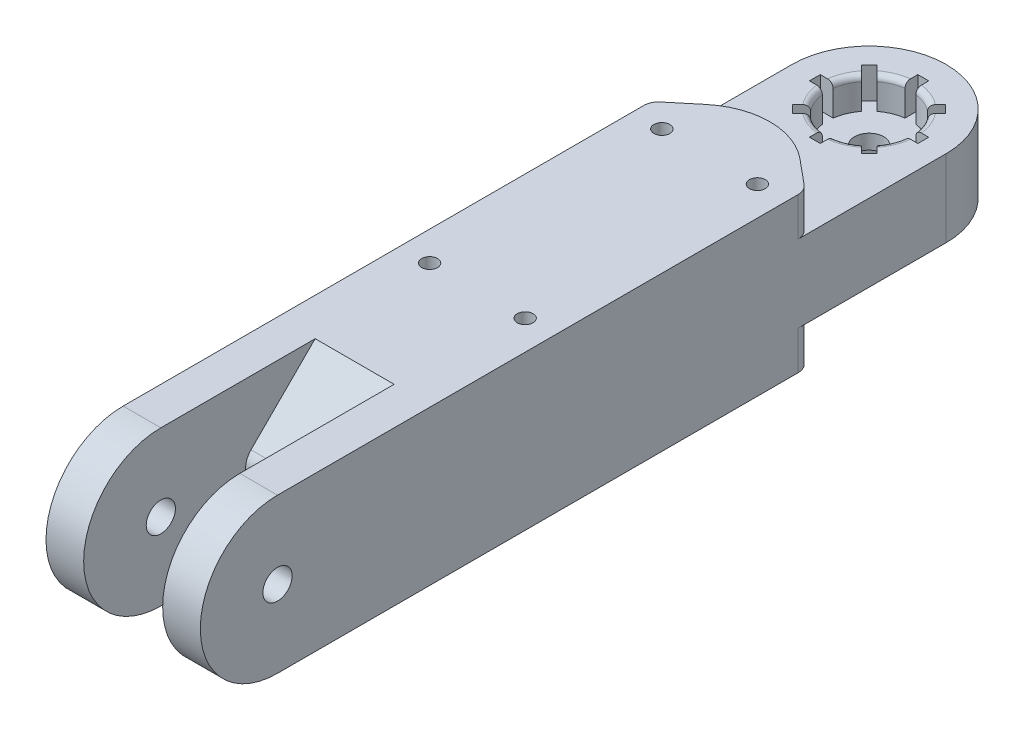
from build123d import *

# Parameters (mm, degrees)
SKETCH1_W                = 42
SKETCH1_H                = 42
BOSS_EXTRUDE1_DEPTH      = 140
SKETCH2_W                = 10.25
SKETCH2_H                = 42
BOSS_EXTRUDE2_DEPTH      = 21
BOSS_EXTRUDE4_DEPTH      = 10.25
BOSS_EXTRUDE5_START      = -10.25
BOSS_EXTRUDE5_DEPTH      = 10.25
SKETCH6_R                = 3.975
CUT_EXTRUDE1_DEPTH       = 186.93832983
SKETCH8_R                = 3.975
CUT_EXTRUDE2_DEPTH       = 186.93832983
SKETCH9_W                = 42
SKETCH9_H                = 21
BOSS_EXTRUDE6_DEPTH      = 21
BOSS_EXTRUDE7_DEPTH      = 21
SKETCH11_R               = 11.35
CUT_EXTRUDE3_DEPTH       = 8.5
CUT_EXTRUDE4_DEPTH       = 21.5
FILLET1_R                = 5
CUT_EXTRUDE5_START       = -8.5
SKETCH18_R               = 11.35
CUT_EXTRUDE5_DEPTH       = 8.5
SKETCH19_R               = 3.975
CUT_EXTRUDE6_DEPTH       = 8.5
FILLET4_R                = 1.5
FILLET5_R                = 1.5
SKETCH20_W               = 2.96
SKETCH20_H               = 3.81
CUT_EXTRUDE7_DEPTH       = 8.5
CIRPATTERN1_COUNT        = 8
MIRROR1_COPY_1_SKETCH_W  = 2.96
MIRROR1_COPY_1_SKETCH_H  = 3.81
MIRROR1_COPY_1_DEPTH     = 8.5
MIRROR1_COPY_2_SKETCH_W  = 2.96
MIRROR1_COPY_2_SKETCH_H  = 3.81
MIRROR1_COPY_2_DEPTH     = 8.5
MIRROR1_COPY_3_SKETCH_W  = 2.96
MIRROR1_COPY_3_SKETCH_H  = 3.81
MIRROR1_COPY_3_DEPTH     = 8.5
MIRROR1_COPY_4_SKETCH_W  = 2.96
MIRROR1_COPY_4_SKETCH_H  = 3.81
MIRROR1_COPY_4_DEPTH     = 8.5
MIRROR1_COPY_5_SKETCH_W  = 2.96
MIRROR1_COPY_5_SKETCH_H  = 3.81
MIRROR1_COPY_5_DEPTH     = 8.5
MIRROR1_COPY_6_SKETCH_W  = 2.96
MIRROR1_COPY_6_SKETCH_H  = 3.81
MIRROR1_COPY_6_DEPTH     = 8.5
MIRROR1_COPY_7_SKETCH_W  = 2.96
MIRROR1_COPY_7_SKETCH_H  = 3.81
MIRROR1_COPY_7_DEPTH     = 8.5
MIRROR1_COPY_8_SKETCH_W  = 2.96
MIRROR1_COPY_8_SKETCH_H  = 3.81
MIRROR1_COPY_8_DEPTH     = 8.5
SKETCH25_W               = 34
SKETCH25_H               = 49
CUT_EXTRUDE11_DEPTH      = 32
SKETCH26_W               = 34
SKETCH26_H               = 11.1
CUT_EXTRUDE12_DEPTH      = 27
SKETCH30_R               = 2.15
CUT_EXTRUDE13_DEPTH      = 186.186392589
FILLET10_R               = 3
MIRROR12_COPY_1_SKETCH_R = 2.15
MIRROR12_COPY_1_DEPTH    = 186.186392589
FILLET10_OF_MIRROR12_R   = 3
CUT_EXTRUDE16_DEPTH      = 10.5
FILLET12_R               = 20
FILLET12_OF_MIRROR13_R   = 20
FILLET13_R               = 4


with BuildPart() as part:
    # Sketch1 → Boss-Extrude1 (new body)
    with BuildSketch(Plane.XY):
        Rectangle(SKETCH1_W, SKETCH1_H)
    extrude(amount=BOSS_EXTRUDE1_DEPTH)

    # Sketch2 → Boss-Extrude2 (add)
    with BuildSketch(Plane.XY.offset(140)):
        with Locations((-15.875, 0)):
            Rectangle(SKETCH2_W, SKETCH2_H)
        with Locations((15.875, 0)):
            Rectangle(SKETCH2_W, SKETCH2_H)
    extrude(amount=BOSS_EXTRUDE2_DEPTH)

    # Sketch5 → Boss-Extrude4 (add)
    with BuildSketch(Plane.ZY.offset(-10.75)):
        with BuildLine():
            ThreePointArc((161, -21), (182, 0), (161, 21))
            Line((161, 21), (161, -21))
        make_face()
    extrude(amount=-BOSS_EXTRUDE4_DEPTH)

    # Sketch3 → Boss-Extrude5 (add)
    with BuildSketch(Plane(origin=(-10.75, 0, 0), x_dir=(0, 0, -1), z_dir=(1, 0, 0)).offset(BOSS_EXTRUDE5_START)):
        with BuildLine():
            Line((-161, -21), (-161, 21))
            ThreePointArc((-161, 21), (-182, 0), (-161, -21))
        make_face()
    extrude(amount=BOSS_EXTRUDE5_DEPTH)

    # Sketch6 → Cut-Extrude1 (cut, through all)
    with BuildSketch(Plane.ZY.offset(-10.75)):
        with Locations((161, 0)):
            Circle(SKETCH6_R)
    extrude(amount=-CUT_EXTRUDE1_DEPTH, mode=Mode.SUBTRACT)

    # Sketch8 → Cut-Extrude2 (cut, through all)
    with BuildSketch(Plane(origin=(-10.75, 0, 0), x_dir=(0, 0, -1), z_dir=(1, 0, 0))):
        with Locations((-161, 0)):
            Circle(SKETCH8_R)
    extrude(amount=-CUT_EXTRUDE2_DEPTH, mode=Mode.SUBTRACT)

    # Sketch9 → Boss-Extrude6 (add)
    with BuildSketch(Plane(origin=(0, 0, 0), x_dir=(-1, 0, 0), z_dir=(0, 0, -1))):
        Rectangle(SKETCH9_W, SKETCH9_H)
    extrude(amount=BOSS_EXTRUDE6_DEPTH)

    # Sketch10 → Boss-Extrude7 (add)
    with BuildSketch(Plane(origin=(0, -10.5, 0), x_dir=(-1, 0, 0), z_dir=(0, -1, 0))):
        with BuildLine():
            Line((-21, 21), (21, 21))
            ThreePointArc((21, 21), (0, 42), (-21, 21))
        make_face()
    extrude(amount=-BOSS_EXTRUDE7_DEPTH)

    # Sketch11 → Cut-Extrude3 (cut)
    with BuildSketch(Plane(origin=(0, -10.5, 0), x_dir=(-1, 0, 0), z_dir=(0, -1, 0))):
        with Locations((0, 21)):
            Circle(SKETCH11_R)
    extrude(amount=-CUT_EXTRUDE3_DEPTH, mode=Mode.SUBTRACT)

    # Sketch16 → Cut-Extrude4 (cut)
    with BuildSketch(Plane.ZY.offset(-10.75)):
        Polygon((140, -21), (140, 0), (119, -21), align=None)
        Polygon((140, 0), (140, 21), (119, 21), align=None)
    extrude(amount=CUT_EXTRUDE4_DEPTH, mode=Mode.SUBTRACT)

    # Fillet1
    fillet1_edges = [part.edges().sort_by_distance(p)[0] for p in [
        (0, 0, 140),
    ]]
    fillet(fillet1_edges, radius=FILLET1_R)

    # Sketch18 → Cut-Extrude5 (cut)
    with BuildSketch(Plane(origin=(0, 10.5, 0), x_dir=(1, 0, 0), z_dir=(0, 1, 0)).offset(CUT_EXTRUDE5_START)):
        with Locations((0, 21)):
            Circle(SKETCH18_R)
    extrude(amount=CUT_EXTRUDE5_DEPTH, mode=Mode.SUBTRACT)

    # Sketch19 → Cut-Extrude6 (cut)
    with BuildSketch(Plane.XZ.offset(2)):
        with Locations((0, -21)):
            Circle(SKETCH19_R)
    extrude(amount=-CUT_EXTRUDE6_DEPTH, mode=Mode.SUBTRACT)

    # Fillet4
    fillet4_edges = [part.edges().sort_by_distance(p)[0] for p in [
        (11.35, -10.5, -21),
    ]]
    fillet(fillet4_edges, radius=FILLET4_R)

    # Fillet5
    fillet5_edges = [part.edges().sort_by_distance(p)[0] for p in [
        (-11.35, 10.5, -21),
    ]]
    fillet(fillet5_edges, radius=FILLET5_R)

    # Sketch20 → Cut-Extrude7 (cut)
    with BuildSketch(Plane(origin=(0, 10.5, 0), x_dir=(1, 0, 0), z_dir=(0, 1, 0))):
        with Locations((0, 33.85)):
            Rectangle(SKETCH20_W, SKETCH20_H)
    cut_extrude7 = extrude(amount=-CUT_EXTRUDE7_DEPTH, mode=Mode.SUBTRACT)

    # CirPattern1: Cut-Extrude7 ×8 about axis
    cirpattern1_axis = Axis((0, 2, -21), (0, 1, 0))
    for i in range(1, CIRPATTERN1_COUNT):
        add(cut_extrude7.rotate(cirpattern1_axis, i * 360 / CIRPATTERN1_COUNT), mode=Mode.SUBTRACT)

    # Mirror1 copy 1 sketch → Mirror1 copy 1 (cut)
    with BuildSketch(Plane(origin=(14.849242405, -10.5, -6.150757595), x_dir=(0.7071067811865476, 0, -0.7071067811865475), z_dir=(0, -1, 0))):
        with Locations((0, -33.85)):
            Rectangle(MIRROR1_COPY_1_SKETCH_W, MIRROR1_COPY_1_SKETCH_H)
    extrude(amount=-MIRROR1_COPY_1_DEPTH, mode=Mode.SUBTRACT)

    # Mirror1 copy 2 sketch → Mirror1 copy 2 (cut)
    with BuildSketch(Plane(origin=(21, -10.5, -21), x_dir=(0, 0, -1), z_dir=(0, -1, 0))):
        with Locations((0, -33.85)):
            Rectangle(MIRROR1_COPY_2_SKETCH_W, MIRROR1_COPY_2_SKETCH_H)
    extrude(amount=-MIRROR1_COPY_2_DEPTH, mode=Mode.SUBTRACT)

    # Mirror1 copy 3 sketch → Mirror1 copy 3 (cut)
    with BuildSketch(Plane(origin=(14.849242405, -10.5, -35.849242405), x_dir=(-0.7071067811865475, 0, -0.7071067811865476), z_dir=(0, -1, 0))):
        with Locations((0, -33.85)):
            Rectangle(MIRROR1_COPY_3_SKETCH_W, MIRROR1_COPY_3_SKETCH_H)
    extrude(amount=-MIRROR1_COPY_3_DEPTH, mode=Mode.SUBTRACT)

    # Mirror1 copy 4 sketch → Mirror1 copy 4 (cut)
    with BuildSketch(Plane(origin=(0, -10.5, -42), x_dir=(-1, 0, 0), z_dir=(0, -1, 0))):
        with Locations((0, -33.85)):
            Rectangle(MIRROR1_COPY_4_SKETCH_W, MIRROR1_COPY_4_SKETCH_H)
    extrude(amount=-MIRROR1_COPY_4_DEPTH, mode=Mode.SUBTRACT)

    # Mirror1 copy 5 sketch → Mirror1 copy 5 (cut)
    with BuildSketch(Plane(origin=(-14.849242405, -10.5, -35.849242405), x_dir=(-0.7071067811865477, 0, 0.7071067811865475), z_dir=(0, -1, 0))):
        with Locations((0, -33.85)):
            Rectangle(MIRROR1_COPY_5_SKETCH_W, MIRROR1_COPY_5_SKETCH_H)
    extrude(amount=-MIRROR1_COPY_5_DEPTH, mode=Mode.SUBTRACT)

    # Mirror1 copy 6 sketch → Mirror1 copy 6 (cut)
    with BuildSketch(Plane(origin=(-21, -10.5, -21), x_dir=(0, 0, 1), z_dir=(0, -1, 0))):
        with Locations((0, -33.85)):
            Rectangle(MIRROR1_COPY_6_SKETCH_W, MIRROR1_COPY_6_SKETCH_H)
    extrude(amount=-MIRROR1_COPY_6_DEPTH, mode=Mode.SUBTRACT)

    # Mirror1 copy 7 sketch → Mirror1 copy 7 (cut)
    with BuildSketch(Plane(origin=(-14.849242405, -10.5, -6.150757595), x_dir=(0.7071067811865474, 0, 0.7071067811865477), z_dir=(0, -1, 0))):
        with Locations((0, -33.85)):
            Rectangle(MIRROR1_COPY_7_SKETCH_W, MIRROR1_COPY_7_SKETCH_H)
    extrude(amount=-MIRROR1_COPY_7_DEPTH, mode=Mode.SUBTRACT)

    # Mirror1 copy 8 sketch → Mirror1 copy 8 (cut)
    with BuildSketch(Plane.XZ.offset(10.5)):
        with Locations((0, -33.85)):
            Rectangle(MIRROR1_COPY_8_SKETCH_W, MIRROR1_COPY_8_SKETCH_H)
    extrude(amount=-MIRROR1_COPY_8_DEPTH, mode=Mode.SUBTRACT)

    # Sketch25 → Cut-Extrude11 (cut)
    with BuildSketch(Plane.XZ.offset(21)):
        with Locations((0, 54)):
            Rectangle(SKETCH25_W, SKETCH25_H)
    extrude(amount=-CUT_EXTRUDE11_DEPTH, mode=Mode.SUBTRACT)

    # Sketch26 → Cut-Extrude12 (cut)
    with BuildSketch(Plane.XZ.offset(21)):
        with Locations((0, 23.95)):
            Rectangle(SKETCH26_W, SKETCH26_H)
    cut_extrude12 = extrude(amount=-CUT_EXTRUDE12_DEPTH, mode=Mode.SUBTRACT)

    # Sketch30 → Cut-Extrude13 (cut, through all)
    with BuildSketch(Plane.XZ.offset(-6)):
        with Locations((-13, 22.4)):
            Circle(SKETCH30_R)
    cut_extrude13 = extrude(amount=-CUT_EXTRUDE13_DEPTH, mode=Mode.SUBTRACT)

    # Mirror9: Cut-Extrude13 across plane
    add(cut_extrude13.mirror(Plane.ZY), mode=Mode.SUBTRACT)

    # Fillet10
    fillet10_edges = [part.edges().sort_by_distance(p)[0] for p in [
        (-17, -7.5, 18.4),
        (17, -7.5, 18.4),
    ]]
    fillet(fillet10_edges, radius=FILLET10_R)

    # Mirror12: Cut-Extrude12, Cut-Extrude13 across plane
    add(cut_extrude12.mirror(Plane(origin=(0, 0, 54), x_dir=(1, 0, 0), z_dir=(0, 0, -1))), mode=Mode.SUBTRACT)
    add(cut_extrude13.mirror(Plane(origin=(0, 0, 54), x_dir=(1, 0, 0), z_dir=(0, 0, -1))), mode=Mode.SUBTRACT)

    # Mirror12 copy 1 sketch → Mirror12 copy 1 (cut, through all)
    with BuildSketch(Plane(origin=(0, 6, 108), x_dir=(-1, 0, 0), z_dir=(0, -1, 0))):
        with Locations((-13, 22.4)):
            Circle(MIRROR12_COPY_1_SKETCH_R)
    extrude(amount=-MIRROR12_COPY_1_DEPTH, mode=Mode.SUBTRACT)

    # Fillet10 of Mirror12
    fillet10_of_mirror12_edges = [part.edges().sort_by_distance(p)[0] for p in [
        (-17, -7.5, 89.6),
        (17, -7.5, 89.6),
    ]]
    fillet(fillet10_of_mirror12_edges, radius=FILLET10_OF_MIRROR12_R)

    # Sketch32 → Cut-Extrude16 (cut)
    with BuildSketch(Plane(origin=(0, 21, 0), x_dir=(1, 0, 0), z_dir=(0, 1, 0))):
        Polygon((21, 0), (0, 0), (21, -17.421516408), align=None)
        Polygon((-21, -17.421516408), (0, 0), (-21, 0), align=None)
    cut_extrude16 = extrude(amount=-CUT_EXTRUDE16_DEPTH, mode=Mode.SUBTRACT)

    # Fillet12
    fillet12_edges = [part.edges().sort_by_distance(p)[0] for p in [
        (0, 15.75, 0),
    ]]
    fillet(fillet12_edges, radius=FILLET12_R)

    # Mirror13: Cut-Extrude16 across plane
    add(cut_extrude16.mirror(Plane.ZX), mode=Mode.SUBTRACT)

    # Fillet12 of Mirror13
    fillet12_of_mirror13_edges = [part.edges().sort_by_distance(p)[0] for p in [
        (0, -15.75, 0),
    ]]
    fillet(fillet12_of_mirror13_edges, radius=FILLET12_OF_MIRROR13_R)

    # Fillet13
    fillet13_edges = [part.edges().sort_by_distance(p)[0] for p in [
        (-21, 15.75, 17.421516408),
        (-21, -15.75, 17.421516408),
        (21, -15.75, 17.421516408),
        (21, 15.75, 17.421516408),
    ]]
    fillet(fillet13_edges, radius=FILLET13_R)


solid = part.part
